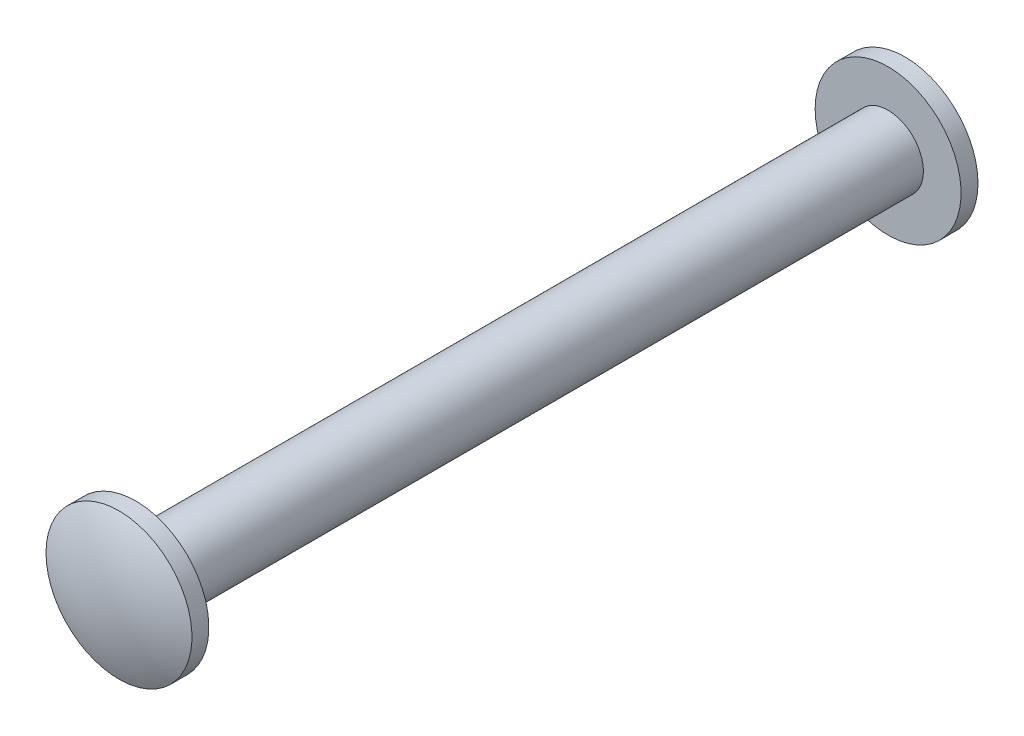
from build123d import *
from OCP.BRepFilletAPI import BRepFilletAPI_MakeChamfer

# Parameters (mm, degrees)
SKETCH1_R           = 1.190625
EXTRUDE1_DEPTH      = 12.7
SKETCH1_W           = 9.8552
SKETCH1_H           = 1.27
EXTRUDE1_2_DEPTH    = 12.7
SKETCH20_R          = 1.4224
EXTRUDE24_DEPTH     = 20.045522232
CHAMFER2_SIZE       = 0.635
CHAMFER2_SIZE2      = 0.551997079
EXTRUDE4_DEPTH      = 19.94700397
EXTRUDE4_DEPTH_BACK = 19.94700397
SKETCH8_W           = 5.6896
SKETCH8_H           = 8.466666666
SKETCH9_R           = 1.190625
EXTRUDE5_DEPTH      = 8.466666667


# Read off the part's stored shape, not the designer's step: Mirror2
with BuildPart() as part:
    # Sketch1 → Extrude1 (new, symmetric)
    with BuildSketch(Plane.XY):
        with BuildLine():
            Line((12.7, -2.157017049), (1.190625, -2.157017049))
            ThreePointArc((1.190625, -2.157017049), (-1.856577095, 1.619701185), (2.298588957, -0.887017049))
            Line((2.298588957, -0.887017049), (12.7, -0.887017049))
            Line((12.7, -0.887017049), (12.7, -2.157017049))
        make_face()
        Circle(SKETCH1_R, mode=Mode.SUBTRACT)
    extrude(amount=EXTRUDE1_DEPTH, both=True)

    # Mirror2 outline → Mirror2 (revolve, cut)
    with BuildSketch(Plane(origin=(8.3312, 0, -7.8486), x_dir=(1, 0, 0), z_dir=(0, 0, 1))):
        Polygon((1.784715731, -0.887017049), (0, -0.887017049), (0, -1.93881362), (1.4224, -1.93881362), (1.4224, -1.30381362), align=None)
    revolve(axis=Axis((8.3312, 0, -7.8486), (0, 1, 0)), mode=Mode.SUBTRACT)

    # Mirror2 2 outline → Mirror2 2 (revolve, cut)
    with BuildSketch(Plane(origin=(8.3312, 0, 7.8486), x_dir=(1, 0, 0), z_dir=(0, 0, 1))):
        Polygon((0, -0.887017049), (0, -1.93881362), (1.4224, -1.93881362), (1.4224, -1.30381362), (1.784715731, -0.887017049), align=None)
    revolve(axis=Axis((8.3312, 0, 7.8486), (0, 1, 0)), mode=Mode.SUBTRACT)

    # Sketch8 → Extrude4 (cut, two sides: drawn at the far end of the back side and taken through both)
    with BuildSketch(Plane(origin=(0, 0, 0), x_dir=(1, 0, 0), z_dir=(0, 1, 0)).offset(-EXTRUDE4_DEPTH_BACK)):
        Rectangle(SKETCH8_W, SKETCH8_H)
    extrude(amount=EXTRUDE4_DEPTH + EXTRUDE4_DEPTH_BACK, mode=Mode.SUBTRACT)


with BuildPart() as body_2:
    # Sketch1 → Extrude1 2 (new, symmetric)
    with BuildSketch(Plane.XY):
        with Locations((-7.7724, -1.30381362)):
            Rectangle(SKETCH1_W, SKETCH1_H)
    extrude(amount=EXTRUDE1_2_DEPTH, both=True)

    # Sketch20 → Extrude24 (cut, through all)
    with BuildSketch(Plane(origin=(0, -0.66881362, 0), x_dir=(1, 0, 0), z_dir=(0, 1, 0))):
        with Locations(Location((-8.3312, 7.8486, 0), (0, 0, 270))):
            Circle(SKETCH20_R)
        with Locations(Location((-8.3312, -7.8486, 0), (0, 0, 270))):
            Circle(SKETCH20_R)
    extrude(amount=-EXTRUDE24_DEPTH, mode=Mode.SUBTRACT)

    # Chamfer2: one chamfer whose edges measure the first distance from different faces: ONE call of the kernel's chamfer builder (chamfer() names one face for all edges)
    chamfer2_edges_1 = [body_2.edges().sort_by_distance(p)[0] for p in [
        (-8.3312, -0.66881362, -9.271),
    ]]
    chamfer2_side_1 = [body_2.faces().sort_by_distance(p)[0] for p in [
        (-8.3312, -1.30381362, -9.271),
    ]]
    chamfer2_edges_2 = [body_2.edges().sort_by_distance(p)[0] for p in [
        (-8.3312, -0.66881362, 6.4262),
    ]]
    chamfer2_side_2 = [body_2.faces().sort_by_distance(p)[0] for p in [
        (-8.3312, -1.30381362, 6.4262),
    ]]
    chamfer2 = BRepFilletAPI_MakeChamfer(body_2.part.solid().wrapped)
    for e in chamfer2_edges_1:
        chamfer2.Add(CHAMFER2_SIZE, CHAMFER2_SIZE2, e.wrapped, chamfer2_side_1[0].wrapped)  # the first distance lies on this face
    for e in chamfer2_edges_2:
        chamfer2.Add(CHAMFER2_SIZE, CHAMFER2_SIZE2, e.wrapped, chamfer2_side_2[0].wrapped)  # the first distance lies on this face
    add(Compound.cast(chamfer2.Shape()), mode=Mode.REPLACE)

    # Sketch9 → Extrude5 (add)
    with BuildSketch(Plane.XY.offset(-4.233333333)):
        with BuildLine():
            Line((-2.371286314, -0.66881362), (-2.8448, -0.66881362))
            Line((-2.8448, -0.66881362), (-2.8448, -1.93881362))
            Line((-2.8448, -1.93881362), (-1.520300032, -1.93881362))
            ThreePointArc((-1.520300032, -1.93881362), (2.046786768, 1.371486189), (-2.371286314, -0.66881362))
        make_face()
        with Locations(Location((0, 0, 0), (0, 0, 180))):
            Circle(SKETCH9_R, mode=Mode.SUBTRACT)
    extrude(amount=EXTRUDE5_DEPTH)


with BuildPart() as body_3:
    # Sketch6 → Revolve1 (revolve)
    with BuildSketch(Plane(origin=(0, 0, 0), x_dir=(1, 0, 0), z_dir=(0, 1, 0))):
        with BuildLine():
            Line((-2.4638, -12.7), (-2.4638, -13.2715))
            ThreePointArc((-2.4638, -13.2715), (-1.264606924, -13.698253184), (0, -13.843))
            Line((0, -13.843), (0, 13.843))
            ThreePointArc((0, 13.843), (-1.264606924, 13.698253184), (-2.4638, 13.2715))
            Line((-2.4638, 13.2715), (-2.4638, 12.7))
            Line((-2.4638, 12.7), (-1.190625, 12.7))
            Line((-1.190625, 12.7), (-1.190625, -12.7))
            Line((-1.190625, -12.7), (-2.4638, -12.7))
        make_face()
    revolve(axis=Axis((0, 0, -13.843), (0, 0, 1)))


solid = body_3.part
